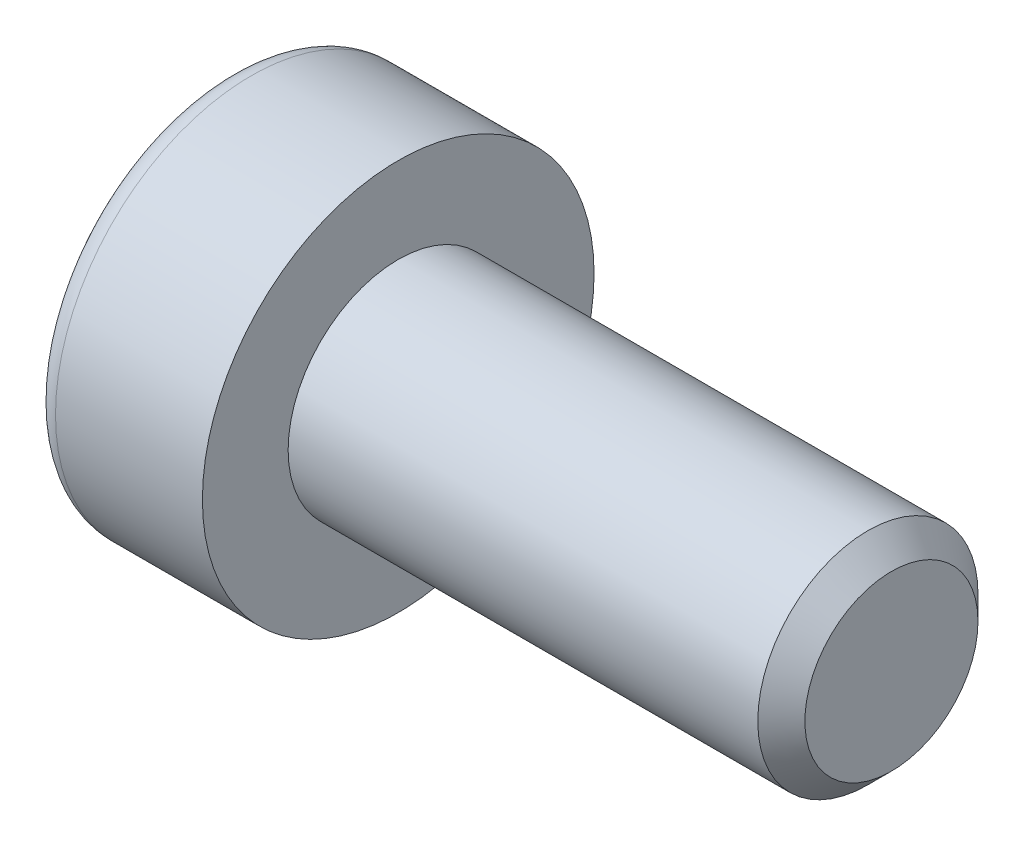
from build123d import *

# Parameters (mm, degrees)
ENL_V_MAT_EXTRU_1_DEPTH = 2
CONG_1_R                = 0.5


with BuildPart() as part:
    # Esquisse1 → Révolution2 (revolve)
    with BuildSketch(Plane.XY):
        Polygon((-324.272441776, -82.233261292), (-324.272441776, -80.350712582), (-324.784792339, -79.838362019), (-335, -79.838362019), (-335, -77.973749244), (-338.695213442, -77.973749244), (-338.695213442, -82.233261292), align=None)
    revolve(axis=Axis((-324.272441776, -82.233261292, 0), (-1, 0, 0)))

    # Esquisse2 → Enlèv. mat.-Extru.1 (cut)
    with BuildSketch(Plane.ZY.offset(338.695213442)):
        Polygon((-0.337114985, -79.829469696), (-2.25030208, -81.323315634), (-1.913187095, -83.72710723), (0.337114985, -84.637052887), (2.25030208, -83.143206949), (1.913187095, -80.739415353), align=None)
    extrude(amount=-ENL_V_MAT_EXTRU_1_DEPTH, mode=Mode.SUBTRACT)

    # Congé1
    cong_1_edges = [part.edges().sort_by_distance(p)[0] for p in [
        (-338.695213442, -86.492773339, 0),
    ]]
    fillet(cong_1_edges, radius=CONG_1_R)


solid = part.part
